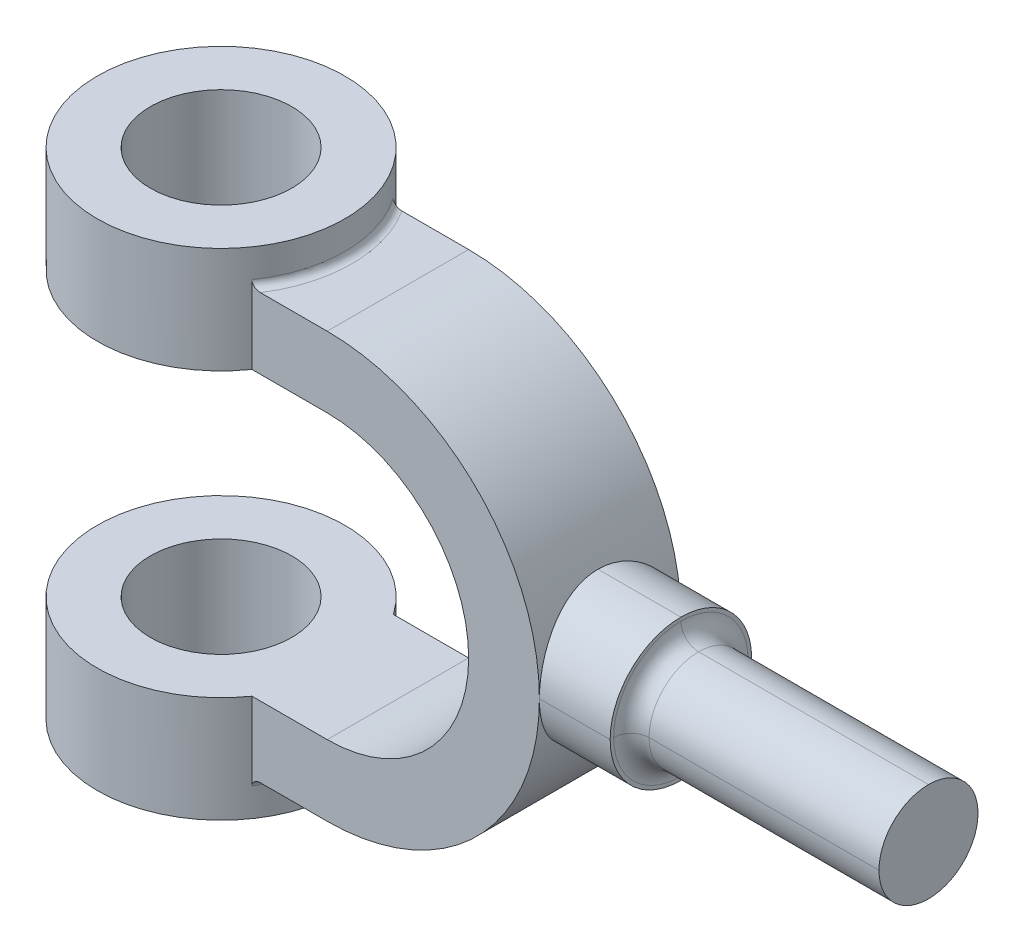
from build123d import *

# Parameters (mm, degrees)
SKETCH3_R                = 35
SKETCH3_R_2              = 20
BOSS_EXTRUDE1_DEPTH      = 30
LPATTERN2_COUNT          = 2
LPATTERN2_PITCH          = 110
BOSS_EXTRUDE2_DEPTH      = 20
BOSS_EXTRUDE2_DEPTH_BACK = 20
FILLET1_R                = 2
BOSS_EXTRUDE3_DEPTH      = 20
BOSS_EXTRUDE3_DEPTH_BACK = 20
SKETCH6_W                = 40
SKETCH6_H                = 30
BOSS_EXTRUDE4_DEPTH      = 14
BOSS_EXTRUDE4_DEPTH_BACK = 14
SKETCH6_3_W              = 28
SKETCH6_3_H              = 70
FILLET2_R                = 14
FILLET3_R                = 20
FILLET4_R                = 5


with BuildPart() as part:
    # Sketch3 → Boss-Extrude1 (new body)
    with BuildSketch(Plane(origin=(0, 0, 0), x_dir=(1, 0, 0), z_dir=(0, 1, 0))):
        with Locations(Location((0, 0, 0), (0, 0, 270))):
            Circle(SKETCH3_R)
        with Locations(Location((0, 0, 0), (0, 0, 270))):
            Circle(SKETCH3_R_2, mode=Mode.SUBTRACT)
    extrude(amount=BOSS_EXTRUDE1_DEPTH)


with BuildPart() as lpattern2_1:
    # LPattern2: pattern copy
    add(part.part.moved(Location(Vector(0, 1, 0) * (1 * LPATTERN2_PITCH))))


with BuildPart() as part_1:
    add(part.part)

    add(lpattern2_1.part)  # Boss-Extrude2 merges LPattern2_1
    # Sketch5 → Boss-Extrude2 (add, two sides: drawn at the far end of the back side and taken through both)
    with BuildSketch(Plane(origin=(0, 0, 0), x_dir=(0, -1, 0), z_dir=(0, 0, 1)).offset(-BOSS_EXTRUDE2_DEPTH_BACK)):
        with BuildLine():
            Line((-10, 21.3), (-10, 50))
            ThreePointArc((-10, 50), (-70, 110), (-130, 50))
            Line((-130, 50), (-130, 21.3))
            Line((-130, 21.3), (-110, 21.3))
            Line((-110, 21.3), (-110, 50))
            ThreePointArc((-110, 50), (-70, 90), (-30, 50))
            Line((-30, 50), (-30, 21.3))
            Line((-30, 21.3), (-10, 21.3))
        make_face()
    extrude(amount=BOSS_EXTRUDE2_DEPTH + BOSS_EXTRUDE2_DEPTH_BACK)

    # Fillet1
    fillet1_edges = [part_1.edges().sort_by_distance(p)[0] for p in [
        (35, 10, 0),
        (35, 130, 0),
    ]]
    fillet(fillet1_edges, radius=FILLET1_R)

    # Sketch6 → Boss-Extrude3 (add, two sides: drawn at the far end of the back side and taken through both)
    with BuildSketch(Plane(origin=(0, 0, 0), x_dir=(0, -1, 0), z_dir=(0, 0, 1)).offset(-BOSS_EXTRUDE3_DEPTH_BACK)):
        with Locations((-70, 115)):
            Rectangle(SKETCH6_W, SKETCH6_H)
    extrude(amount=BOSS_EXTRUDE3_DEPTH + BOSS_EXTRUDE3_DEPTH_BACK)

    # Sketch6<3> → Boss-Extrude4 (add, two sides: drawn at the far end of the back side and taken through both)
    with BuildSketch(Plane(origin=(0, 0, 0), x_dir=(0, -1, 0), z_dir=(0, 0, 1)).offset(-BOSS_EXTRUDE4_DEPTH_BACK)):
        with Locations((-70, 165)):
            Rectangle(SKETCH6_3_W, SKETCH6_3_H)
    extrude(amount=BOSS_EXTRUDE4_DEPTH + BOSS_EXTRUDE4_DEPTH_BACK)

    # Fillet2
    fillet2_edges = [part_1.edges().sort_by_distance(p)[0] for p in [
        (165, 56, -14),
        (165, 56, 14),
        (165, 84, 14),
        (165, 84, -14),
    ]]
    fillet(fillet2_edges, radius=FILLET2_R - 0.0001)  # a hair under: the kernel refuses the full size

    # Fillet3
    fillet3_edges = [part_1.edges().sort_by_distance(p)[0] for p in [
        (118.284271247, 50, -20),
        (118.284271247, 50, 20),
        (118.284271247, 90, 20),
        (118.284271247, 90, -20),
    ]]
    fillet(fillet3_edges, radius=FILLET3_R - 0.0001)  # a hair under: the kernel refuses the full size

    # Fillet4
    fillet4_edges = [part_1.edges().sort_by_distance(p)[0] for p in [
        (130, 60.100475774, -9.899524226),
        (130, 60.100475774, 9.899524226),
        (130, 79.899524226, 9.899524226),
        (130, 79.899524226, -9.899524226),
    ]]
    fillet(fillet4_edges, radius=FILLET4_R)


solid = part_1.part
